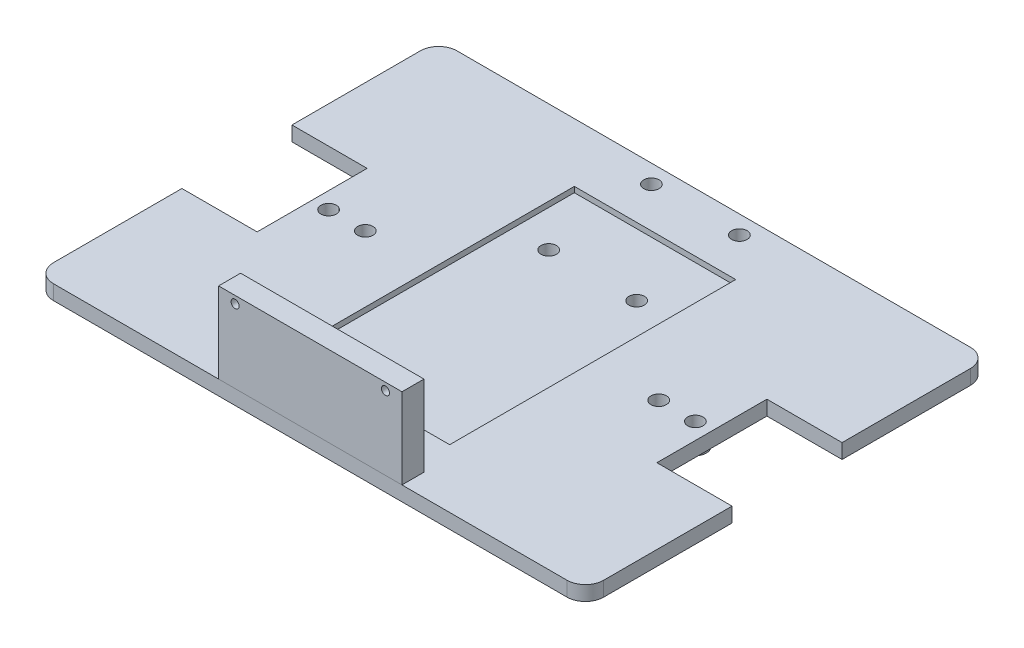
from build123d import *

# Parameters (mm, degrees)
SKETCH1_W           = 150
SKETCH1_H           = 110
BOSS_EXTRUDE1_DEPTH = 4
FILLET1_R           = 5
SKETCH2_R           = 2.1
CUT_EXTRUDE1_DEPTH  = 94.091352982
SKETCH3_R           = 3
BOSS_EXTRUDE2_DEPTH = 2
CUT_EXTRUDE2_DEPTH  = 1.5
SKETCH7_W           = 50
SKETCH7_H           = 22
BOSS_EXTRUDE4_DEPTH = 6
SKETCH8_R           = 1.1
CUT_EXTRUDE3_DEPTH  = 131.831953284
SKETCH10_R          = 2.1
CUT_EXTRUDE5_DEPTH  = 96.571962416
SKETCH11_W          = 20.5
SKETCH11_H          = 30
CUT_EXTRUDE6_DEPTH  = 96.571962416
SKETCH12_R          = 4
BOSS_EXTRUDE5_DEPTH = 3.5
SKETCH13_R          = 2.1
CUT_EXTRUDE7_DEPTH  = 96.571962416


with BuildPart() as part:
    # Sketch1 → Boss-Extrude1 (new body)
    with BuildSketch(Plane(origin=(0, 0, 0), x_dir=(1, 0, 0), z_dir=(0, 1, 0))):
        Rectangle(SKETCH1_W, SKETCH1_H)
    extrude(amount=BOSS_EXTRUDE1_DEPTH)

    # Fillet1
    fillet1_edges = [part.edges().sort_by_distance(p)[0] for p in [
        (-75, 2, -55),
        (-75, 2, 55),
        (75, 2, -55),
        (75, 2, 55),
    ]]
    fillet(fillet1_edges, radius=FILLET1_R)

    # Sketch2 → Cut-Extrude1 (cut, through all)
    with BuildSketch(Plane(origin=(0, 4, 0), x_dir=(1, 0, 0), z_dir=(0, 1, 0))):
        with Locations((-50, 0)):
            Circle(SKETCH2_R)
        with Locations((-40, 0)):
            Circle(SKETCH2_R)
    cut_extrude1 = extrude(amount=-CUT_EXTRUDE1_DEPTH, mode=Mode.SUBTRACT)

    # Sketch3 → Boss-Extrude2 (add)
    with BuildSketch(Plane.XZ):
        with Locations((-50, 0)):
            Circle(SKETCH3_R)
        with Locations((-40, 0)):
            Circle(SKETCH3_R)
    boss_extrude2 = extrude(amount=BOSS_EXTRUDE2_DEPTH)

    # Mirror1: Cut-Extrude1, Boss-Extrude2 across plane
    add(cut_extrude1.mirror(Plane(origin=(0, 0, 0), x_dir=(0, 0, 1), z_dir=(1, 0, 0))), mode=Mode.SUBTRACT)
    add(boss_extrude2.mirror(Plane(origin=(0, 0, 0), x_dir=(0, 0, 1), z_dir=(1, 0, 0))))

    # Sketch4 → Cut-Extrude2 (cut)
    with BuildSketch(Plane(origin=(0, 4, 0), x_dir=(1, 0, 0), z_dir=(0, 1, 0))):
        Polygon((-22, -39), (-6, -39), (-6, -43), (6, -43), (6, -39), (22, -39), (22, 39), (-22, 39), align=None)
    extrude(amount=-CUT_EXTRUDE2_DEPTH, mode=Mode.SUBTRACT)

    # Sketch10 → Cut-Extrude5 (cut, through all)
    with BuildSketch(Plane(origin=(0, 4, 0), x_dir=(1, 0, 0), z_dir=(0, 1, 0))):
        with Locations((-50, 0)):
            Circle(SKETCH10_R)
        with Locations((-40, 0)):
            Circle(SKETCH10_R)
        with Locations((40, 0)):
            Circle(SKETCH10_R)
        with Locations((50, 0)):
            Circle(SKETCH10_R)
    extrude(amount=-CUT_EXTRUDE5_DEPTH, mode=Mode.SUBTRACT)

    # Sketch11 → Cut-Extrude6 (cut, through all)
    with BuildSketch(Plane(origin=(0, 4, 0), x_dir=(1, 0, 0), z_dir=(0, 1, 0))):
        with Locations((64.75, 0)):
            Rectangle(SKETCH11_W, SKETCH11_H)
        with Locations((-64.75, 0)):
            Rectangle(SKETCH11_W, SKETCH11_H)
    extrude(amount=-CUT_EXTRUDE6_DEPTH, mode=Mode.SUBTRACT)

    # Sketch12 → Boss-Extrude5 (add)
    with BuildSketch(Plane.XZ):
        with Locations((-12, -22)):
            Circle(SKETCH12_R)
        with Locations((12, -22)):
            Circle(SKETCH12_R)
        with Locations((12, -50)):
            Circle(SKETCH12_R)
        with Locations((-12, -50)):
            Circle(SKETCH12_R)
    extrude(amount=BOSS_EXTRUDE5_DEPTH)

    # Sketch13 → Cut-Extrude7 (cut, through all)
    with BuildSketch(Plane(origin=(0, 4, 0), x_dir=(1, 0, 0), z_dir=(0, 1, 0))):
        with Locations((12, 22)):
            Circle(SKETCH13_R)
        with Locations((-12, 50)):
            Circle(SKETCH13_R)
        with Locations((12, 50)):
            Circle(SKETCH13_R)
        with Locations((-12, 22)):
            Circle(SKETCH13_R)
    extrude(amount=-CUT_EXTRUDE7_DEPTH, mode=Mode.SUBTRACT)


with BuildPart() as body_2:
    # Sketch7 → Boss-Extrude4 (new body)
    with BuildSketch(Plane.XY.offset(55)):
        with Locations((0, 15)):
            Rectangle(SKETCH7_W, SKETCH7_H)
    extrude(amount=-BOSS_EXTRUDE4_DEPTH)

    # Sketch8 → Cut-Extrude3 (cut, through all)
    with BuildSketch(Plane(origin=(0, 0, 49), x_dir=(-1, 0, 0), z_dir=(0, 0, -1))):
        with Locations((-20.5, 24)):
            Circle(SKETCH8_R)
        with Locations((20.5, 24)):
            Circle(SKETCH8_R)
    extrude(amount=-CUT_EXTRUDE3_DEPTH, mode=Mode.SUBTRACT)


solid = Compound([part.part, body_2.part])
